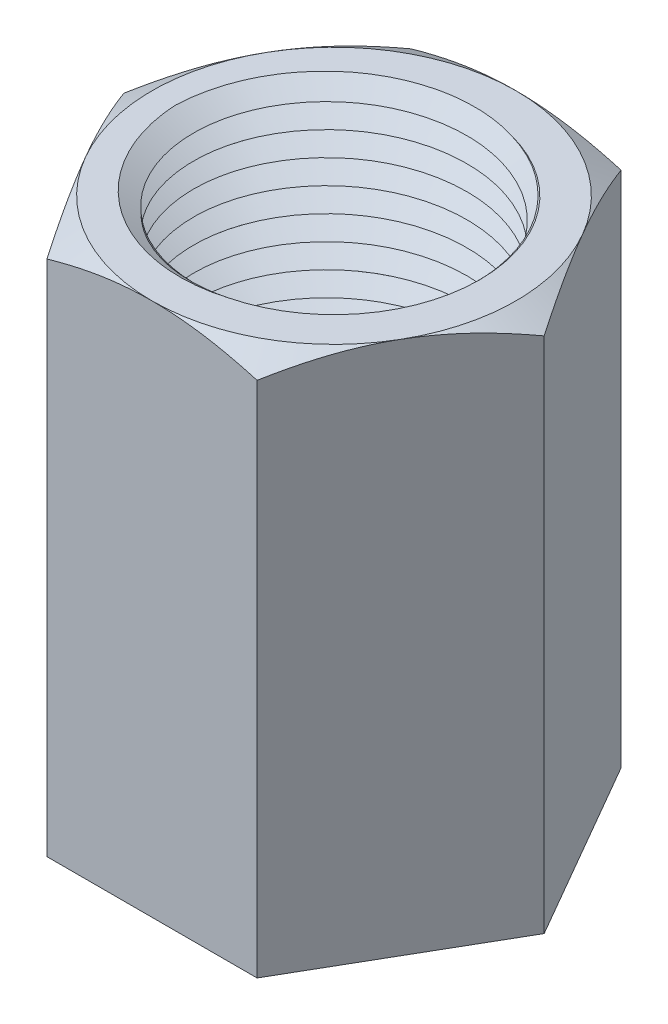
from build123d import *

# Parameters (mm, degrees)
BOSS_EXTRUDE1_DEPTH = 22
SKETCH2_R           = 5.5
CUT_EXTRUDE1_DEPTH  = 22
SKETCH3_OUTSIDE_W   = 29.138
SKETCH3_OUTSIDE_H   = 26.818
SKETCH3_OUTSIDE_R   = 7.5
CUT_EXTRUDE2_DEPTH  = 1
CUT_EXTRUDE2_DRAFT  = -60
CHAMFER2_SIZE       = 0.5
CUT_SWEEP3_PITCH    = 1


with BuildPart() as part:
    # Sketch1 → Boss-Extrude1 (new body)
    with BuildSketch(Plane(origin=(0, 0, 0), x_dir=(1, 0, 0), z_dir=(0, 1, 0))):
        Polygon((8.660254038, 0), (4.330127019, 7.5), (-4.330127019, 7.5), (-8.660254038, 0), (-4.330127019, -7.5), (4.330127019, -7.5), align=None)
    extrude(amount=BOSS_EXTRUDE1_DEPTH)

    # Sketch2 → Cut-Extrude1 (cut)
    with BuildSketch(Plane(origin=(0, 22, 0), x_dir=(1, 0, 0), z_dir=(0, 1, 0))):
        with Locations(Location((0, 0, 0), (0, 0, 270))):
            Circle(SKETCH2_R)
    extrude(amount=-CUT_EXTRUDE1_DEPTH, mode=Mode.SUBTRACT)


with BuildPart() as cut_extrude2_tool:
    # Sketch3 outside → Cut-Extrude2 (with draft: the straight prism first)
    with BuildSketch(Plane(origin=(0, 22, 0), x_dir=(1, 0, 0), z_dir=(0, 1, 0))):
        Rectangle(SKETCH3_OUTSIDE_W, SKETCH3_OUTSIDE_H)
        Circle(SKETCH3_OUTSIDE_R, mode=Mode.SUBTRACT)
    extrude(amount=-CUT_EXTRUDE2_DEPTH)
    # Cut-Extrude2: the draft: its side faces are tilted about the plane it starts from
    cut_extrude2_sides = [cut_extrude2_tool.faces().sort_by_distance(p)[0] for p in [
        (0, 21.5, 13.409),
        (14.569, 21.5, 0),
        (0, 21.5, -13.409),
        (-14.569, 21.5, 0),
        (-7.5, 21.5, 0),
    ]]
    draft(cut_extrude2_sides, Plane(origin=(0, 22, 0), x_dir=(1, 0, 0), z_dir=(0, 1, 0)), CUT_EXTRUDE2_DRAFT)


with BuildPart() as part_1:
    add(part.part)

    # Cut-Extrude2: cut by cut_extrude2_tool
    add(cut_extrude2_tool.part, mode=Mode.SUBTRACT)

    # Chamfer2
    chamfer2_edges = [part_1.edges().sort_by_distance(p)[0] for p in [
        (0, 22, -5.5),
    ]]
    chamfer(chamfer2_edges, length=CHAMFER2_SIZE)

    # Cut-Sweep3: the profile of Sketch6 screwed along a right-hand helix of 34 turns, 8 arcs to a turn; built about Z, then put on its axis
    cut_sweep3_z = Axis((0, 0, 0), (0, 0, 1))
    cut_sweep3_corners = [(6.5, 0, 0), (5, 0, 0.866025404), (5, 0, -0.866025404)]
    with BuildLine(mode=Mode.PRIVATE) as cut_sweep3_profile:
        Line(cut_sweep3_corners[0], cut_sweep3_corners[1])
        Line(cut_sweep3_corners[1], cut_sweep3_corners[2])
        Line(cut_sweep3_corners[2], cut_sweep3_corners[0])
    cut_sweep3_cap = Face(cut_sweep3_profile.wire())
    cut_sweep3_turn_angles = [0, 22.5, 45, 67.5, 90, 112.5, 135, 157.5, 180, 202.5, 225, 247.5, 270, 292.5, 315, 337.5, 360]
    cut_sweep3_turn_weights = [1, 0.9238795325112867, 1, 0.9238795325112867, 1, 0.9238795325112867, 1, 0.9238795325112867, 1, 0.9238795325112867, 1, 0.9238795325112867, 1, 0.9238795325112867, 1, 0.9238795325112867, 1]
    cut_sweep3_turn_rails = [Edge.make_bspline([Vector(p[0], p[1], 0).rotate(cut_sweep3_z, cut_sweep3_turn_angles[k]) / cut_sweep3_turn_weights[k] + Vector(0, 0, p[2] + CUT_SWEEP3_PITCH * cut_sweep3_turn_angles[k] / 360) for k in range(17)], [0, 0, 0, 1, 1, 2, 2, 3, 3, 4, 4, 5, 5, 6, 6, 7, 7, 8, 8, 8], 2, cut_sweep3_turn_weights) for p in cut_sweep3_corners]
    cut_sweep3_turn_sides = [Face.make_surface_from_curves(cut_sweep3_turn_rails[p[0]], cut_sweep3_turn_rails[p[1]]) for p in [(0, 1), (1, 2), (2, 0)]]
    cut_sweep3_turn = Solid(Shell([*cut_sweep3_turn_sides, cut_sweep3_cap, cut_sweep3_cap.rotate(cut_sweep3_z, 360).moved(Location((0, 0, CUT_SWEEP3_PITCH * 360 / 360)))]))
    cut_sweep3_each = [*[cut_sweep3_turn.moved(Location((0, 0, CUT_SWEEP3_PITCH * i))) for i in range(34)]]
    add(Plane(origin=(0, 32, 0), x_dir=(-1, 0, 0), z_dir=(0, -1, 0)) * Compound([cut_sweep3_each[i] for i in range(0, 34, 2)]), mode=Mode.SUBTRACT)
    add(Plane(origin=(0, 32, 0), x_dir=(-1, 0, 0), z_dir=(0, -1, 0)) * Compound([cut_sweep3_each[i] for i in range(1, 34, 2)]), mode=Mode.SUBTRACT)


solid = part_1.part
